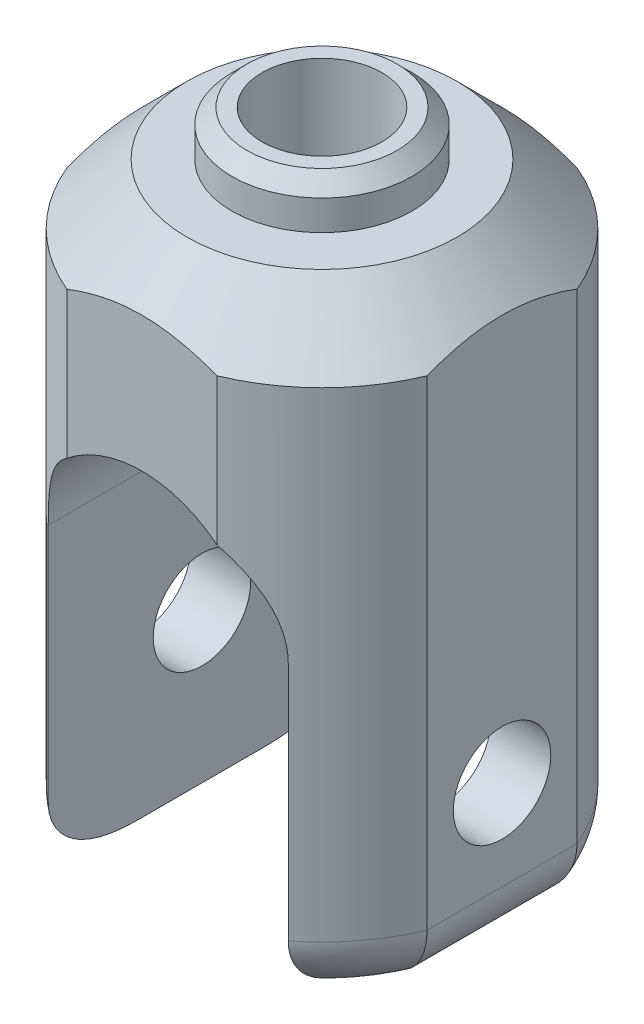
from build123d import *

# Parameters (mm, degrees)
SKETCH1_R               = 13
BOSS_EXTRUDE1_DEPTH     = 40
CHAMFER1_SIZE           = 4
SKETCH2_W               = 9.245775376
SKETCH2_H               = 49.025160165
CUT_EXTRUDE1_DEPTH      = 20
SKETCH3_W               = 9.286622431
SKETCH3_H               = 52.181973662
CUT_EXTRUDE2_DEPTH      = 20
CUT_EXTRUDE3_DEPTH      = 20
FILLET9_R               = 4
CUT_EXTRUDE4_REACH      = 50.166
SKETCH5_R               = 3.25
SKETCH6_R               = 6
BOSS_EXTRUDE2_DEPTH     = 3
CUT_EXTRUDE5_REACH      = 48.228
CUT_EXTRUDE5_END_RADIUS = 8
SKETCH7_R               = 4
CHAMFER2_SIZE           = 1


with BuildPart() as part:
    # Sketch1 → Boss-Extrude1 (new body)
    with BuildSketch(Plane(origin=(0, 0, 0), x_dir=(1, 0, 0), z_dir=(0, 1, 0))):
        with Locations(Location((0, 0, 0), (0, 0, 270))):
            Circle(SKETCH1_R)
    extrude(amount=BOSS_EXTRUDE1_DEPTH)

    # Chamfer1
    chamfer1_edges = [part.edges().sort_by_distance(p)[0] for p in [
        (0, 40, -13),
    ]]
    chamfer(chamfer1_edges, length=CHAMFER1_SIZE)

    # Sketch2 → Cut-Extrude1 (cut, symmetric)
    with BuildSketch(Plane(origin=(0, 0, 0), x_dir=(0, 0, -1), z_dir=(1, 0, 0))):
        with Locations((-16.622887688, 20.157854701)):
            Rectangle(SKETCH2_W, SKETCH2_H)
        with Locations((16.622887688, 20.157854701)):
            Rectangle(SKETCH2_W, SKETCH2_H)
    extrude(amount=CUT_EXTRUDE1_DEPTH, both=True, mode=Mode.SUBTRACT)

    # Sketch3 → Cut-Extrude2 (cut, symmetric)
    with BuildSketch(Plane.XY):
        with Locations((16.643311215, 16.67537129)):
            Rectangle(SKETCH3_W, SKETCH3_H)
        with Locations((-16.643311215, 16.67537129)):
            Rectangle(SKETCH3_W, SKETCH3_H)
    extrude(amount=CUT_EXTRUDE2_DEPTH, both=True, mode=Mode.SUBTRACT)

    # Sketch4 → Cut-Extrude3 (cut, symmetric)
    with BuildSketch(Plane.XY):
        with BuildLine():
            Line((8, 20), (8, 0))
            Line((8, 0), (-8, 0))
            Line((-8, 0), (-8, 20))
            ThreePointArc((-8, 20), (0, 28), (8, 20))
        make_face()
    extrude(amount=CUT_EXTRUDE3_DEPTH, both=True, mode=Mode.SUBTRACT)

    # Fillet9
    # the kernel refuses this fillet: 4 mm, written as the material it takes off along each edge
    with BuildSketch(Plane(origin=(0, 0, 0), x_dir=(0.9307006586833979, 0, 0.3657817435661457), z_dir=(-0.3657817435661457, 0, 0.9307006586833979))) as fillet9_piece_1:
        with BuildLine():
            CenterArc((13 - FILLET9_R, FILLET9_R), FILLET9_R, 270, 90)
            Line((13 - FILLET9_R, 0), (13, 0))
            Line((13, 0), (13, FILLET9_R))
        make_face()
    revolve(axis=Axis((0, 0, 0), (0, 1, 0)), revolution_arc=117.551393411, mode=Mode.SUBTRACT)
    with BuildSketch(Plane(origin=(0, 0, 0), x_dir=(-0.9307006586833977, 0, -0.36578174356614573), z_dir=(0.36578174356614573, 0, -0.9307006586833977))) as fillet9_piece_2:
        with BuildLine():
            CenterArc((13 - FILLET9_R, FILLET9_R), FILLET9_R, 270, 90)
            Line((13, FILLET9_R), (13, 0))
            Line((13, 0), (13 - FILLET9_R, 0))
        make_face()
    revolve(axis=Axis((0, 0, 0), (0, 1, 0)), revolution_arc=117.551393411, mode=Mode.SUBTRACT)
    with BuildSketch(Plane(origin=(12, 0, -15), x_dir=(0, 1, 0), z_dir=(0, 0, 1)), Plane(origin=(-12, 0, -15), x_dir=(1, 0, 0), z_dir=(0, 0, 1))) as fillet9_piece_3:
        with BuildLine():
            CenterArc((FILLET9_R, FILLET9_R), FILLET9_R, 180, 90)
            Line((0, FILLET9_R), (0, 0))
            Line((0, 0), (FILLET9_R, 0))
        make_face()
    extrude(amount=30, mode=Mode.SUBTRACT)
    with BuildSketch(Plane(origin=(0, 0, 0), x_dir=(-0.1061893245847588, 0, 0.9943459294150264), z_dir=(-0.9943459294150264, 0, -0.1061893245847588))) as fillet9_piece_4:
        with BuildLine():
            CenterArc((13 - FILLET9_R, FILLET9_R), FILLET9_R, 270, 90)
            Line((13 - FILLET9_R, 0), (13, 0))
            Line((13, 0), (13, FILLET9_R))
        make_face()
    revolve(axis=Axis((0, 0, 0), (0, 1, 0)), revolution_arc=117.551393411, mode=Mode.SUBTRACT)
    with BuildSketch(Plane(origin=(0, 0, 0), x_dir=(0.10618932458475924, 0, -0.9943459294150264), z_dir=(0.9943459294150264, 0, 0.10618932458475924))) as fillet9_piece_5:
        with BuildLine():
            CenterArc((13 - FILLET9_R, FILLET9_R), FILLET9_R, 270, 90)
            Line((13 - FILLET9_R, 0), (13, 0))
            Line((13, 0), (13, FILLET9_R))
        make_face()
    revolve(axis=Axis((0, 0, 0), (0, 1, 0)), revolution_arc=117.551393411, mode=Mode.SUBTRACT)

    # Cut-Extrude4: up to this face of the body (flat: up to its plane)
    cut_extrude4_end = Plane(part.part.faces().sort_by_distance((-12, 20.3320271, 0))[0])
    # Sketch5 → Cut-Extrude4 (cut, up to the picked face)
    with BuildSketch(Plane(origin=(12, 0, 0), x_dir=(0, 0, -1), z_dir=(1, 0, 0)), mode=Mode.PRIVATE) as cut_extrude4_sk1:
        with Locations(Location((0, 10, 0), (0, 0, 90))):
            Circle(SKETCH5_R)
    cut_extrude4_tool1 = split(extrude(cut_extrude4_sk1.sketch, amount=-CUT_EXTRUDE4_REACH, mode=Mode.PRIVATE), bisect_by=cut_extrude4_end, keep=Keep.BOTH, mode=Mode.PRIVATE)
    add(cut_extrude4_tool1.solids().sort_by(Axis((12, 10, 0), (-1, 0, 0)))[0], mode=Mode.SUBTRACT)

    # Sketch6 → Boss-Extrude2 (add)
    with BuildSketch(Plane(origin=(0, 40, 0), x_dir=(1, 0, 0), z_dir=(0, 1, 0))):
        with Locations(Location((0, 0, 0), (0, 0, 270))):
            Circle(SKETCH6_R)
    extrude(amount=BOSS_EXTRUDE2_DEPTH)

    # Cut-Extrude5: up to this cylinder (the profile starts outside it)
    cut_extrude5_end = Plane(origin=(0, 20, 0), z_dir=(0, 0, 1)) * Cylinder(CUT_EXTRUDE5_END_RADIUS, 113.456, mode=Mode.PRIVATE)
    # Sketch7 → Cut-Extrude5 (cut, up to the surface)
    with BuildSketch(Plane(origin=(0, 43, 0), x_dir=(1, 0, 0), z_dir=(0, 1, 0)), mode=Mode.PRIVATE) as cut_extrude5_sk1:
        with Locations(Location((0, 0, 0), (0, 0, 270))):
            Circle(SKETCH7_R)
    cut_extrude5_tool1 = extrude(cut_extrude5_sk1.sketch, amount=-CUT_EXTRUDE5_REACH, mode=Mode.PRIVATE) - cut_extrude5_end
    add(cut_extrude5_tool1.solids().sort_by_distance((0, 43, 0))[0], mode=Mode.SUBTRACT)

    # Chamfer2
    chamfer2_edges = [part.edges().sort_by_distance(p)[0] for p in [
        (0, 43, -6),
    ]]
    chamfer(chamfer2_edges, length=CHAMFER2_SIZE)


solid = part.part
